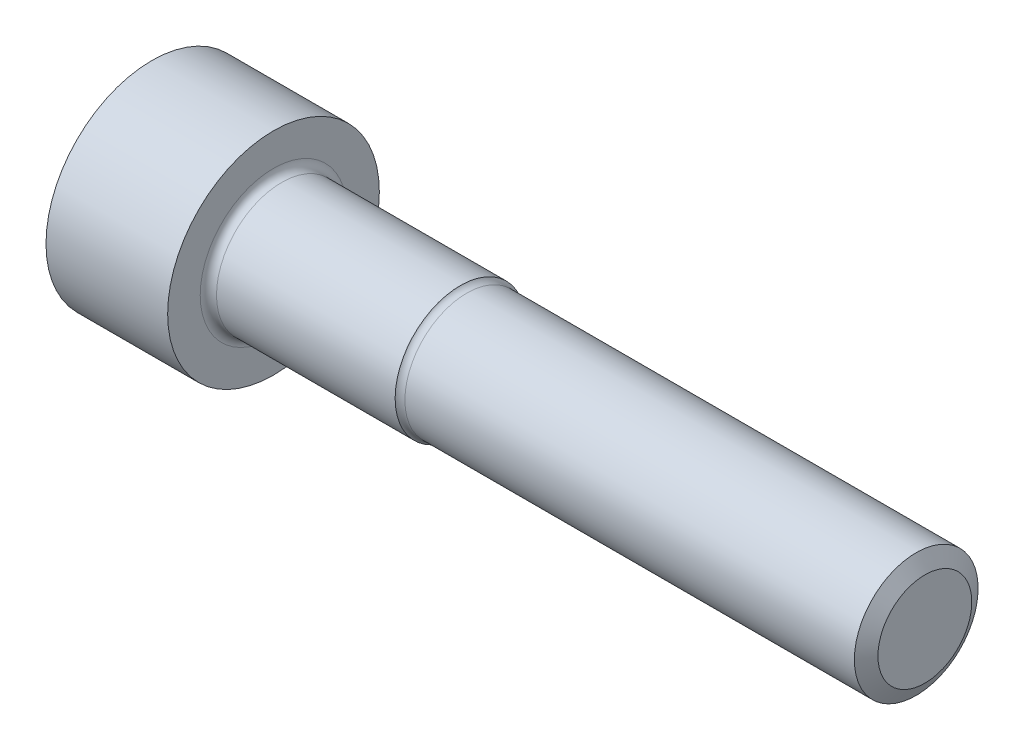
from build123d import *

# Parameters (mm, degrees)
WYTNIJ_WYCI_GNI_CIE1_DEPTH = 4
ZAOKR_GLENIE1_R            = 0.5


with BuildPart() as part:
    # Szkic1 → Obrót1 (revolve)
    with BuildSketch(Plane.XY, mode=Mode.PRIVATE) as obr_t1_sk:
        Polygon((0, 0), (0, 5.582013072), (0.53, 6.5), (8, 6.5), (8, 4), (19.47, 4), (19.47, 3.8), (47.47, 3.8), (48, 2.882013072), (48, 0), align=None)
    revolve(obr_t1_sk.sketch.rotate(Axis((0, 0, 0), (1, 0, 0)), 90), axis=Axis((0, 0, 0), (1, 0, 0)))

    # Szkic2 → Wytnij-wyciągnięcie1 (cut)
    with BuildSketch(Plane.ZY):
        Polygon((0, -3.464101615), (3, -1.732050808), (3, 1.732050808), (0, 3.464101615), (-3, 1.732050808), (-3, -1.732050808), align=None)
    extrude(amount=-WYTNIJ_WYCI_GNI_CIE1_DEPTH, mode=Mode.SUBTRACT)

    # Szkic3 → Wycięcie-obrót1 (revolve, cut)
    with BuildSketch(Plane.XY, mode=Mode.PRIVATE) as wyci_cie_obr_t1_sk:
        Polygon((4, 0), (4, 3.464101615), (5.615337112, 0), align=None)
    revolve(wyci_cie_obr_t1_sk.sketch.rotate(Axis((-0.90277096, 0, 0), (1, 0, 0)), 90), axis=Axis((-0.90277096, 0, 0), (1, 0, 0)), mode=Mode.SUBTRACT)

    # Zaokrąglenie1
    # the kernel refuses this fillet: 0.5 mm, written as the material it adds along each edge
    with BuildSketch(Plane(origin=(19.47, 0, 0), x_dir=(0, 0, 1), z_dir=(0, 1, 0))) as zaokr_glenie1_piece_1:
        with BuildLine():
            CenterArc((4.3, 0.4), ZAOKR_GLENIE1_R, 180, 53.130102355)
            Line((3.8, 0.4), (3.79, 0.4))
            Line((3.79, 0.4), (3.79, 0))
            Line((3.79, 0), (3.8, -0.01))
            ThreePointArc((3.8, -0.01), (3.9, -0.01), (3.994, -0.008))
            Line((3.994, -0.008), (4, 0))
        make_face()
    revolve(axis=Axis((19.47, 0, 0), (1, 0, 0)))
    with BuildSketch(Plane(origin=(8, 0, 0), x_dir=(0, 0, 1), z_dir=(0, 1, 0))) as zaokr_glenie1_piece_2:
        with BuildLine():
            CenterArc((4 + ZAOKR_GLENIE1_R, ZAOKR_GLENIE1_R), ZAOKR_GLENIE1_R, 180, 90)
            Line((4, ZAOKR_GLENIE1_R), (4 - ZAOKR_GLENIE1_R * 0.02, ZAOKR_GLENIE1_R))
            Line((4 - ZAOKR_GLENIE1_R * 0.02, ZAOKR_GLENIE1_R), (4 - ZAOKR_GLENIE1_R * 0.02, -ZAOKR_GLENIE1_R * 0.02))
            Line((4 - ZAOKR_GLENIE1_R * 0.02, -ZAOKR_GLENIE1_R * 0.02), (4 + ZAOKR_GLENIE1_R, -ZAOKR_GLENIE1_R * 0.02))
            Line((4 + ZAOKR_GLENIE1_R, -ZAOKR_GLENIE1_R * 0.02), (4 + ZAOKR_GLENIE1_R, 0))
        make_face()
    revolve(axis=Axis((8, 0, 0), (1, 0, 0)))


solid = part.part
